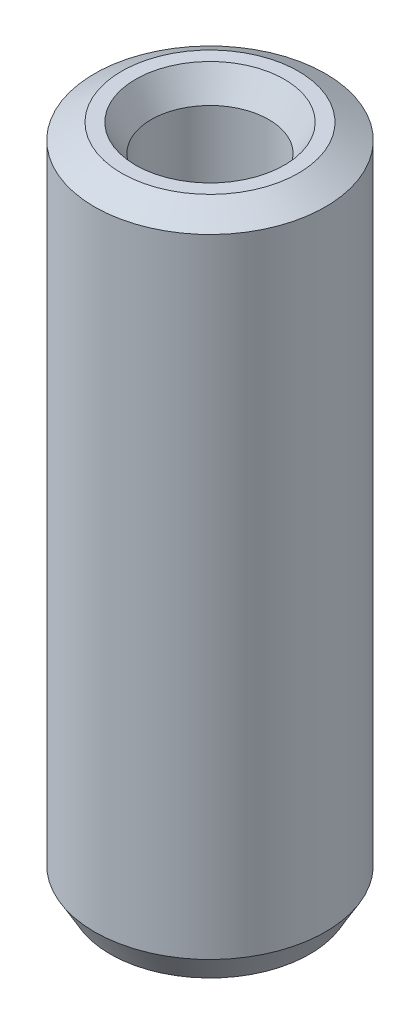
from build123d import *
from OCP.BRepFilletAPI import BRepFilletAPI_MakeChamfer

# Parameters (mm, degrees)
SKETCH1_R           = 17.5
BOSS_EXTRUDE1_DEPTH = 101.632506448
SKETCH2_R           = 8.910844863
CUT_EXTRUDE1_DEPTH  = 105.602420464
CHAMFER1_SIZE       = 2.366939913
CHAMFER1_SIZE2      = 4.099660188


with BuildPart() as part:
    # Sketch1 → Boss-Extrude1 (new body)
    with BuildSketch(Plane(origin=(0, 0, 0), x_dir=(1, 0, 0), z_dir=(0, 1, 0))):
        Circle(SKETCH1_R)
    extrude(amount=BOSS_EXTRUDE1_DEPTH)

    # Sketch2 → Cut-Extrude1 (cut, through all)
    with BuildSketch(Plane(origin=(0, 0, 0), x_dir=(1, 0, 0), z_dir=(0, 1, 0))):
        Circle(SKETCH2_R)
    extrude(amount=CUT_EXTRUDE1_DEPTH, mode=Mode.SUBTRACT)

    # Chamfer1: one chamfer whose edges measure the first distance from different faces: ONE call of the kernel's chamfer builder (chamfer() names one face for all edges)
    chamfer1_edges_1 = [part.edges().sort_by_distance(p)[0] for p in [
        (-8.910844863, 101.632506448, 0),
    ]]
    chamfer1_side_1 = [part.faces().sort_by_distance(p)[0] for p in [
        (-17.005025253, 101.632506448, 0),
    ]]
    chamfer1_edges_2 = [part.edges().sort_by_distance(p)[0] for p in [
        (-8.910844863, 0, 0),
    ]]
    chamfer1_side_2 = [part.faces().sort_by_distance(p)[0] for p in [
        (-8.910844863, 50.816253224, 0),
    ]]
    chamfer1_edges_3 = [part.edges().sort_by_distance(p)[0] for p in [
        (-17.5, 0, 0),
    ]]
    chamfer1_side_3 = [part.faces().sort_by_distance(p)[0] for p in [
        (-17.005025253, 0, 0),
    ]]
    chamfer1_edges_4 = [part.edges().sort_by_distance(p)[0] for p in [
        (-17.5, 101.632506448, 0),
    ]]
    chamfer1_side_4 = [part.faces().sort_by_distance(p)[0] for p in [
        (-17.5, 50.816253224, 0),
    ]]
    chamfer1 = BRepFilletAPI_MakeChamfer(part.part.solid().wrapped)
    for e in chamfer1_edges_1:
        chamfer1.Add(CHAMFER1_SIZE, CHAMFER1_SIZE2, e.wrapped, chamfer1_side_1[0].wrapped)  # the first distance lies on this face
    for e in chamfer1_edges_2:
        chamfer1.Add(CHAMFER1_SIZE, CHAMFER1_SIZE2, e.wrapped, chamfer1_side_2[0].wrapped)  # the first distance lies on this face
    for e in chamfer1_edges_3:
        chamfer1.Add(CHAMFER1_SIZE, CHAMFER1_SIZE2, e.wrapped, chamfer1_side_3[0].wrapped)  # the first distance lies on this face
    for e in chamfer1_edges_4:
        chamfer1.Add(CHAMFER1_SIZE, CHAMFER1_SIZE2, e.wrapped, chamfer1_side_4[0].wrapped)  # the first distance lies on this face
    add(Compound.cast(chamfer1.Shape()), mode=Mode.REPLACE)


solid = part.part
